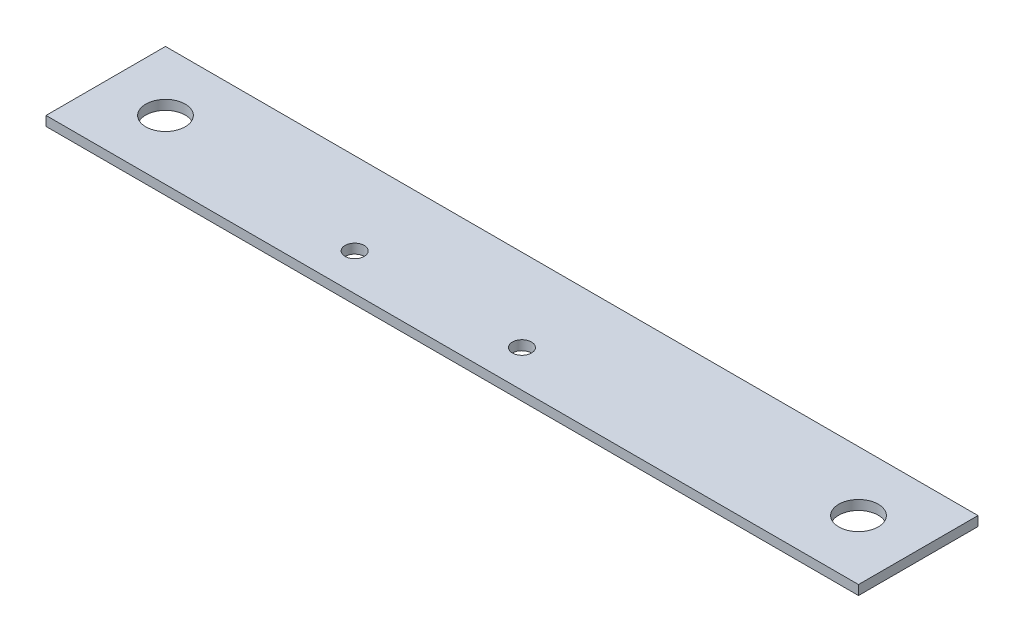
from build123d import *

# Parameters (mm, degrees)
SKETCH1_W           = 170
SKETCH1_H           = 25
SKETCH1_R           = 2
SKETCH1_R_2         = 4.125
BOSS_EXTRUDE1_DEPTH = 2
SKETCH2_R           = 4.125
CUT_EXTRUDE1_DEPTH  = 86.937477273


with BuildPart() as part:
    # Sketch1 → Boss-Extrude1 (new body)
    with BuildSketch(Plane(origin=(0, 0, 0), x_dir=(1, 0, 0), z_dir=(0, 1, 0))):
        Rectangle(SKETCH1_W, SKETCH1_H)
        with Locations((-28.158485727, -4.763382536)):
            Circle(SKETCH1_R, mode=Mode.SUBTRACT)
        with Locations((6.841514273, -4.763382536)):
            Circle(SKETCH1_R, mode=Mode.SUBTRACT)
        with Locations((72.5, 0)):
            Circle(SKETCH1_R_2, mode=Mode.SUBTRACT)
    extrude(amount=BOSS_EXTRUDE1_DEPTH)

    # Sketch2 → Cut-Extrude1 (cut, through all)
    with BuildSketch(Plane(origin=(0, 2, 0), x_dir=(1, 0, 0), z_dir=(0, 1, 0))):
        with Locations((-72.5, 0)):
            Circle(SKETCH2_R)
    extrude(amount=-CUT_EXTRUDE1_DEPTH, mode=Mode.SUBTRACT)


solid = part.part
